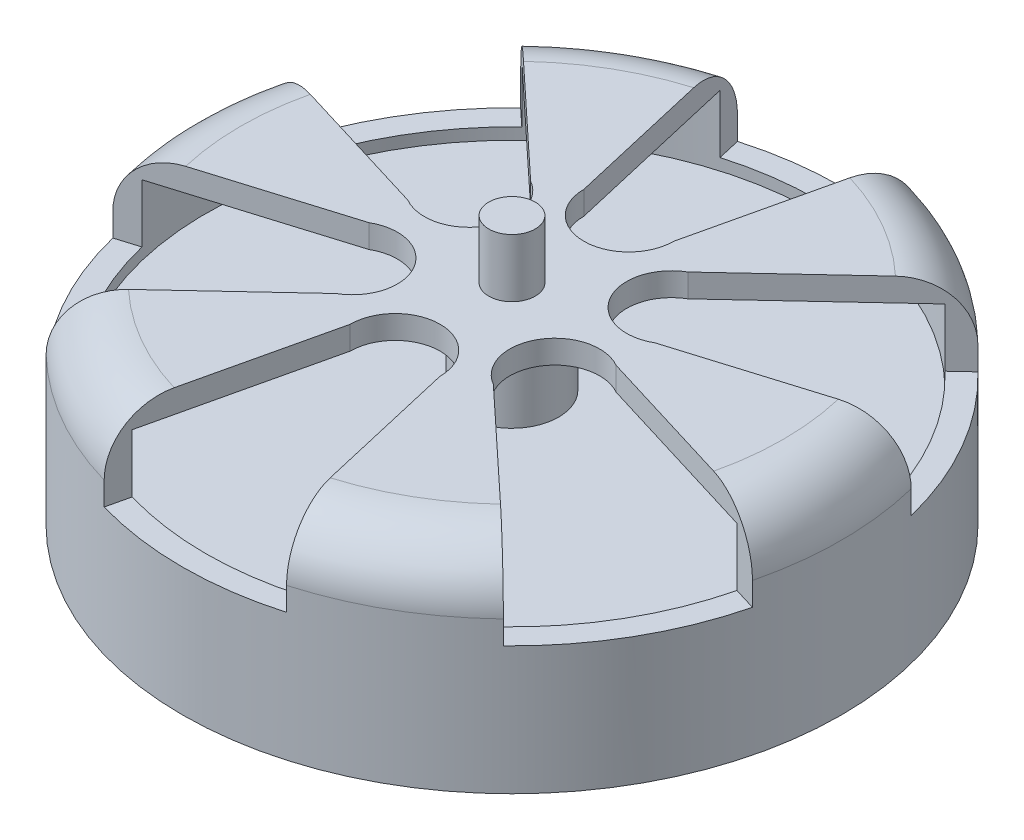
from build123d import *

# Parameters (mm, degrees)
SKETCH2_W          = 22.3
SKETCH2_H          = 6
FILLET1_R          = 5
CUT_EXTRUDE3_DEPTH = 7
CIRPATTERN2_COUNT  = 6
SKETCH5_R          = 2
CUT_EXTRUDE4_DEPTH = 6
CIRPATTERN3_COUNT  = 4
THREAD1_PITCH      = 1.5
THREAD2_PITCH      = 1.5
THREAD3_PITCH      = 1.5
THREAD4_PITCH      = 1.5


with BuildPart() as part:
    # Sketch2 → Revolve1 (revolve)
    with BuildSketch(Plane.XY, mode=Mode.PRIVATE) as revolve1_sk:
        Polygon((4, 22.15), (4, -7.85), (18.8, -7.85), (18.8, -0.85), (32.3, -0.85), (32.3, 17.15), (6, 17.15), (6, 22.15), align=None)
        with Locations((19.15, 12.15)):
            Rectangle(SKETCH2_W, SKETCH2_H, mode=Mode.SUBTRACT)
    revolve(revolve1_sk.sketch.rotate(Axis((4, 22.15, 0), (0, -1, 0)), 90), axis=Axis((4, 22.15, 0), (0, -1, 0)))

    # Fillet1
    fillet1_edges = [part.edges().sort_by_distance(p)[0] for p in [
        (4, 17.15, -28.3),
    ]]
    fillet(fillet1_edges, radius=FILLET1_R)

    # Sketch4 → Cut-Extrude3 (cut)
    with BuildSketch(Plane(origin=(0, 17.15, 0), x_dir=(1, 0, 0), z_dir=(0, 1, 0))):
        with BuildLine():
            Line((0.139030504, -10.032799925), (-4.236444265, -28.946620882))
            Line((-4.236444265, -28.946620882), (12.236444265, -28.946620882))
            Line((12.236444265, -28.946620882), (7.860969496, -10.032799925))
            ThreePointArc((7.860969496, -10.032799925), (4, -6.171830429), (0.139030504, -10.032799925))
        make_face()
    cut_extrude3 = extrude(amount=-CUT_EXTRUDE3_DEPTH, mode=Mode.SUBTRACT)

    # CirPattern2: Cut-Extrude3 ×6 about axis
    cirpattern2_axis = Axis((4, 0, 0), (0, 1, 0))
    for i in range(1, CIRPATTERN2_COUNT):
        add(cut_extrude3.rotate(cirpattern2_axis, i * 360 / CIRPATTERN2_COUNT), mode=Mode.SUBTRACT)

    # Sketch5 → Cut-Extrude4 (cut)
    with BuildSketch(Plane.XZ.offset(7.85)):
        with Locations(Location((13.642, 0, 0), (0, 0, 270))):
            Circle(SKETCH5_R)
    cut_extrude4 = extrude(amount=-CUT_EXTRUDE4_DEPTH, mode=Mode.SUBTRACT)

    # CirPattern3: Cut-Extrude4 ×4 about axis
    cirpattern3_axis = Axis((3.820647321, 0, 0), (0, 1, 0))
    for i in range(1, CIRPATTERN3_COUNT):
        add(cut_extrude4.rotate(cirpattern3_axis, i * 360 / CIRPATTERN3_COUNT), mode=Mode.SUBTRACT)

    # Thread1: the profile of Thread Profile2 profile screwed along a right-hand helix of 4 turns, 8 arcs to a turn; built about Z, then put on its axis
    thread1_z = Axis((0, 0, 0), (0, 0, 1))
    thread1_corners = [(1.9997, 0, -0.000173205), (2.811898812, 0, 0.468749998), (2.811898812, 0, 0.656249998), (1.9997, 0, 1.125173201)]
    with BuildLine(mode=Mode.PRIVATE) as thread1_profile:
        Line(thread1_corners[0], thread1_corners[1])
        Line(thread1_corners[1], thread1_corners[2])
        Line(thread1_corners[2], thread1_corners[3])
        Line(thread1_corners[3], thread1_corners[0])
    thread1_cap = Face(thread1_profile.wire())
    thread1_turn_angles = [0, 22.5, 45, 67.5, 90, 112.5, 135, 157.5, 180, 202.5, 225, 247.5, 270, 292.5, 315, 337.5, 360]
    thread1_turn_weights = [1, 0.9238795325112867, 1, 0.9238795325112867, 1, 0.9238795325112867, 1, 0.9238795325112867, 1, 0.9238795325112867, 1, 0.9238795325112867, 1, 0.9238795325112867, 1, 0.9238795325112867, 1]
    thread1_turn_rails = [Edge.make_bspline([Vector(p[0], p[1], 0).rotate(thread1_z, thread1_turn_angles[k]) / thread1_turn_weights[k] + Vector(0, 0, p[2] + THREAD1_PITCH * thread1_turn_angles[k] / 360) for k in range(17)], [0, 0, 0, 1, 1, 2, 2, 3, 3, 4, 4, 5, 5, 6, 6, 7, 7, 8, 8, 8], 2, thread1_turn_weights) for p in thread1_corners]
    thread1_turn_sides = [Face.make_surface_from_curves(thread1_turn_rails[p[0]], thread1_turn_rails[p[1]]) for p in [(0, 1), (1, 2), (2, 3), (3, 0)]]
    thread1 = Plane(origin=(3.820647321, -1.85, 9.821352679), x_dir=(-1, 0, 0), z_dir=(0, -1, 0)) * Solid(Shell([*[p.moved(Location((0, 0, THREAD1_PITCH * i))) for i in range(4) for p in thread1_turn_sides], thread1_cap, thread1_cap.rotate(thread1_z, 1440).moved(Location((0, 0, THREAD1_PITCH * 1440 / 360)))]))
    add(thread1, mode=Mode.SUBTRACT)

    # Thread2: the profile of Thread Profile3 profile screwed along a right-hand helix of 4 turns, 8 arcs to a turn; built about Z, then put on its axis
    thread2_z = Axis((0, 0, 0), (0, 0, 1))
    thread2_corners = [(1.9997, 0, -0.000173205), (2.811898813, 0, 0.468749998), (2.811898813, 0, 0.656249998), (1.9997, 0, 1.125173201)]
    with BuildLine(mode=Mode.PRIVATE) as thread2_profile:
        Line(thread2_corners[0], thread2_corners[1])
        Line(thread2_corners[1], thread2_corners[2])
        Line(thread2_corners[2], thread2_corners[3])
        Line(thread2_corners[3], thread2_corners[0])
    thread2_cap = Face(thread2_profile.wire())
    thread2_turn_angles = [0, 22.5, 45, 67.5, 90, 112.5, 135, 157.5, 180, 202.5, 225, 247.5, 270, 292.5, 315, 337.5, 360]
    thread2_turn_weights = [1, 0.9238795325112867, 1, 0.9238795325112867, 1, 0.9238795325112867, 1, 0.9238795325112867, 1, 0.9238795325112867, 1, 0.9238795325112867, 1, 0.9238795325112867, 1, 0.9238795325112867, 1]
    thread2_turn_rails = [Edge.make_bspline([Vector(p[0], p[1], 0).rotate(thread2_z, thread2_turn_angles[k]) / thread2_turn_weights[k] + Vector(0, 0, p[2] + THREAD2_PITCH * thread2_turn_angles[k] / 360) for k in range(17)], [0, 0, 0, 1, 1, 2, 2, 3, 3, 4, 4, 5, 5, 6, 6, 7, 7, 8, 8, 8], 2, thread2_turn_weights) for p in thread2_corners]
    thread2_turn_sides = [Face.make_surface_from_curves(thread2_turn_rails[p[0]], thread2_turn_rails[p[1]]) for p in [(0, 1), (1, 2), (2, 3), (3, 0)]]
    thread2 = Plane(origin=(13.642, -1.85, 0), x_dir=(-1, 0, 0), z_dir=(0, -1, 0)) * Solid(Shell([*[p.moved(Location((0, 0, THREAD2_PITCH * i))) for i in range(4) for p in thread2_turn_sides], thread2_cap, thread2_cap.rotate(thread2_z, 1440).moved(Location((0, 0, THREAD2_PITCH * 1440 / 360)))]))
    add(thread2, mode=Mode.SUBTRACT)

    # Thread3: the profile of Thread Profile4 profile screwed along a right-hand helix of 4 turns, 8 arcs to a turn; built about Z, then put on its axis
    thread3_z = Axis((0, 0, 0), (0, 0, 1))
    thread3_corners = [(1.9997, 0, -0.000173205), (2.811898813, 0, 0.468749998), (2.811898813, 0, 0.656249998), (1.9997, 0, 1.125173201)]
    with BuildLine(mode=Mode.PRIVATE) as thread3_profile:
        Line(thread3_corners[0], thread3_corners[1])
        Line(thread3_corners[1], thread3_corners[2])
        Line(thread3_corners[2], thread3_corners[3])
        Line(thread3_corners[3], thread3_corners[0])
    thread3_cap = Face(thread3_profile.wire())
    thread3_turn_angles = [0, 22.5, 45, 67.5, 90, 112.5, 135, 157.5, 180, 202.5, 225, 247.5, 270, 292.5, 315, 337.5, 360]
    thread3_turn_weights = [1, 0.9238795325112867, 1, 0.9238795325112867, 1, 0.9238795325112867, 1, 0.9238795325112867, 1, 0.9238795325112867, 1, 0.9238795325112867, 1, 0.9238795325112867, 1, 0.9238795325112867, 1]
    thread3_turn_rails = [Edge.make_bspline([Vector(p[0], p[1], 0).rotate(thread3_z, thread3_turn_angles[k]) / thread3_turn_weights[k] + Vector(0, 0, p[2] + THREAD3_PITCH * thread3_turn_angles[k] / 360) for k in range(17)], [0, 0, 0, 1, 1, 2, 2, 3, 3, 4, 4, 5, 5, 6, 6, 7, 7, 8, 8, 8], 2, thread3_turn_weights) for p in thread3_corners]
    thread3_turn_sides = [Face.make_surface_from_curves(thread3_turn_rails[p[0]], thread3_turn_rails[p[1]]) for p in [(0, 1), (1, 2), (2, 3), (3, 0)]]
    thread3 = Plane(origin=(-6.000705357, -1.85, 0), x_dir=(-1, 0, 0), z_dir=(0, -1, 0)) * Solid(Shell([*[p.moved(Location((0, 0, THREAD3_PITCH * i))) for i in range(4) for p in thread3_turn_sides], thread3_cap, thread3_cap.rotate(thread3_z, 1440).moved(Location((0, 0, THREAD3_PITCH * 1440 / 360)))]))
    add(thread3, mode=Mode.SUBTRACT)

    # Thread4: the profile of Thread Profile5 profile screwed along a right-hand helix of 4 turns, 8 arcs to a turn; built about Z, then put on its axis
    thread4_z = Axis((0, 0, 0), (0, 0, 1))
    thread4_corners = [(1.9997, 0, -0.000173205), (2.811898812, 0, 0.468749998), (2.811898812, 0, 0.656249998), (1.9997, 0, 1.125173201)]
    with BuildLine(mode=Mode.PRIVATE) as thread4_profile:
        Line(thread4_corners[0], thread4_corners[1])
        Line(thread4_corners[1], thread4_corners[2])
        Line(thread4_corners[2], thread4_corners[3])
        Line(thread4_corners[3], thread4_corners[0])
    thread4_cap = Face(thread4_profile.wire())
    thread4_turn_angles = [0, 22.5, 45, 67.5, 90, 112.5, 135, 157.5, 180, 202.5, 225, 247.5, 270, 292.5, 315, 337.5, 360]
    thread4_turn_weights = [1, 0.9238795325112867, 1, 0.9238795325112867, 1, 0.9238795325112867, 1, 0.9238795325112867, 1, 0.9238795325112867, 1, 0.9238795325112867, 1, 0.9238795325112867, 1, 0.9238795325112867, 1]
    thread4_turn_rails = [Edge.make_bspline([Vector(p[0], p[1], 0).rotate(thread4_z, thread4_turn_angles[k]) / thread4_turn_weights[k] + Vector(0, 0, p[2] + THREAD4_PITCH * thread4_turn_angles[k] / 360) for k in range(17)], [0, 0, 0, 1, 1, 2, 2, 3, 3, 4, 4, 5, 5, 6, 6, 7, 7, 8, 8, 8], 2, thread4_turn_weights) for p in thread4_corners]
    thread4_turn_sides = [Face.make_surface_from_curves(thread4_turn_rails[p[0]], thread4_turn_rails[p[1]]) for p in [(0, 1), (1, 2), (2, 3), (3, 0)]]
    thread4 = Plane(origin=(3.820647321, -1.85, -9.821352679), x_dir=(-1, 0, 0), z_dir=(0, -1, 0)) * Solid(Shell([*[p.moved(Location((0, 0, THREAD4_PITCH * i))) for i in range(4) for p in thread4_turn_sides], thread4_cap, thread4_cap.rotate(thread4_z, 1440).moved(Location((0, 0, THREAD4_PITCH * 1440 / 360)))]))
    add(thread4, mode=Mode.SUBTRACT)


solid = part.part
